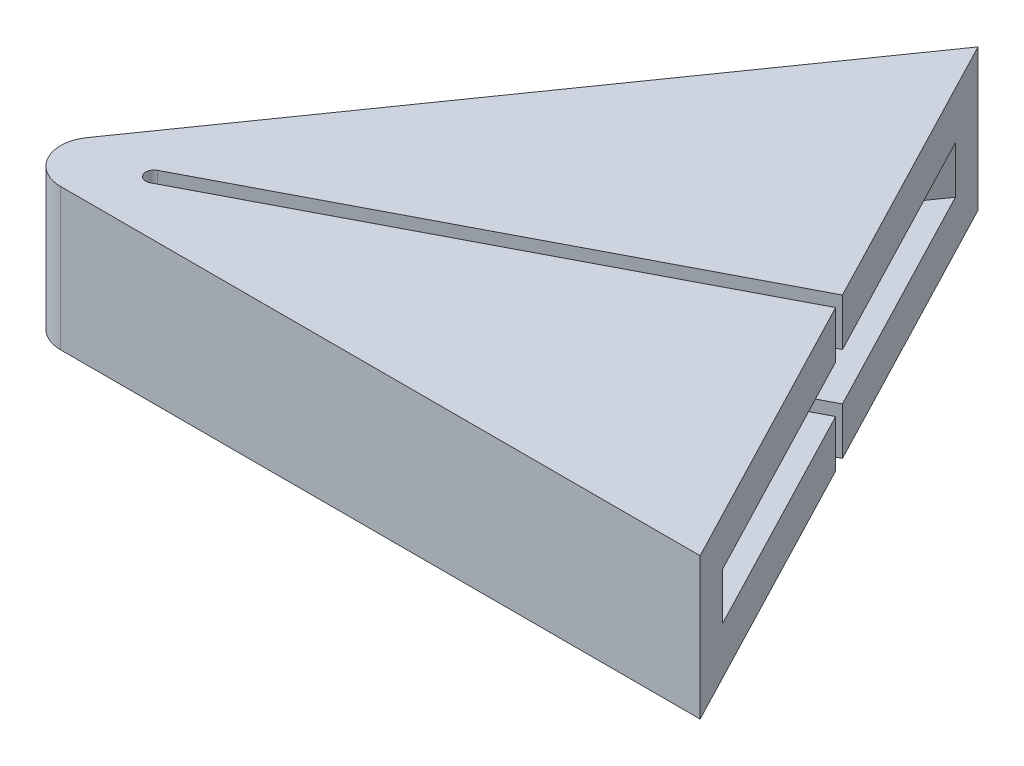
from build123d import *

# Parameters (mm, degrees)
BOSS_EXTRUDE1_DEPTH = 6
SHELL1_START        = 2
SHELL1_DEPTH        = 2
FILLET1_R           = 1.5


# Read off the part's stored shape, not the designer's step: Shell1
with BuildPart() as part:
    # Sketch1 → Boss-Extrude1 (new body)
    with BuildSketch(Plane(origin=(0, 0, 0), x_dir=(1, 0, 0), z_dir=(0, 1, 0))):
        with BuildLine():
            Line((0, 0), (17.207293091, 24.574561329))
            Line((17.207293091, 24.574561329), (23.445639192, 12.590809966))
            Line((23.445639192, 12.590809966), (4.341304412, 2.645722757))
            ThreePointArc((4.341304412, 2.645722757), (4.195782463, 2.184186102), (4.657319118, 2.038664153))
            Line((4.657319118, 2.038664153), (23.761653899, 11.983751363))
            Line((23.761653899, 11.983751363), (30, 0))
            Line((30, 0), (0, 0))
        make_face()
    extrude(amount=BOSS_EXTRUDE1_DEPTH)

    # Shell1 outline → Shell1 (cut)
    with BuildSketch(Plane(origin=(0, 0, 0), x_dir=(1, 0, 0), z_dir=(0, 1, 0)).offset(SHELL1_START)):
        Polygon((4.321177127, 2.68438691), (4.341304412, 2.645722757), (23.445639192, 12.590809966), (18.248427192, 22.574561329), align=None)
        Polygon((23.761653899, 11.983751363), (4.657319118, 2.038664153), (4.677446402, 2), (28.958865899, 2), align=None)
    extrude(amount=SHELL1_DEPTH, mode=Mode.SUBTRACT)

    # Fillet1
    fillet1_edges = [part.edges().sort_by_distance(p)[0] for p in [
        (0, 3, 0),
    ]]
    fillet(fillet1_edges, radius=FILLET1_R)


solid = part.part
